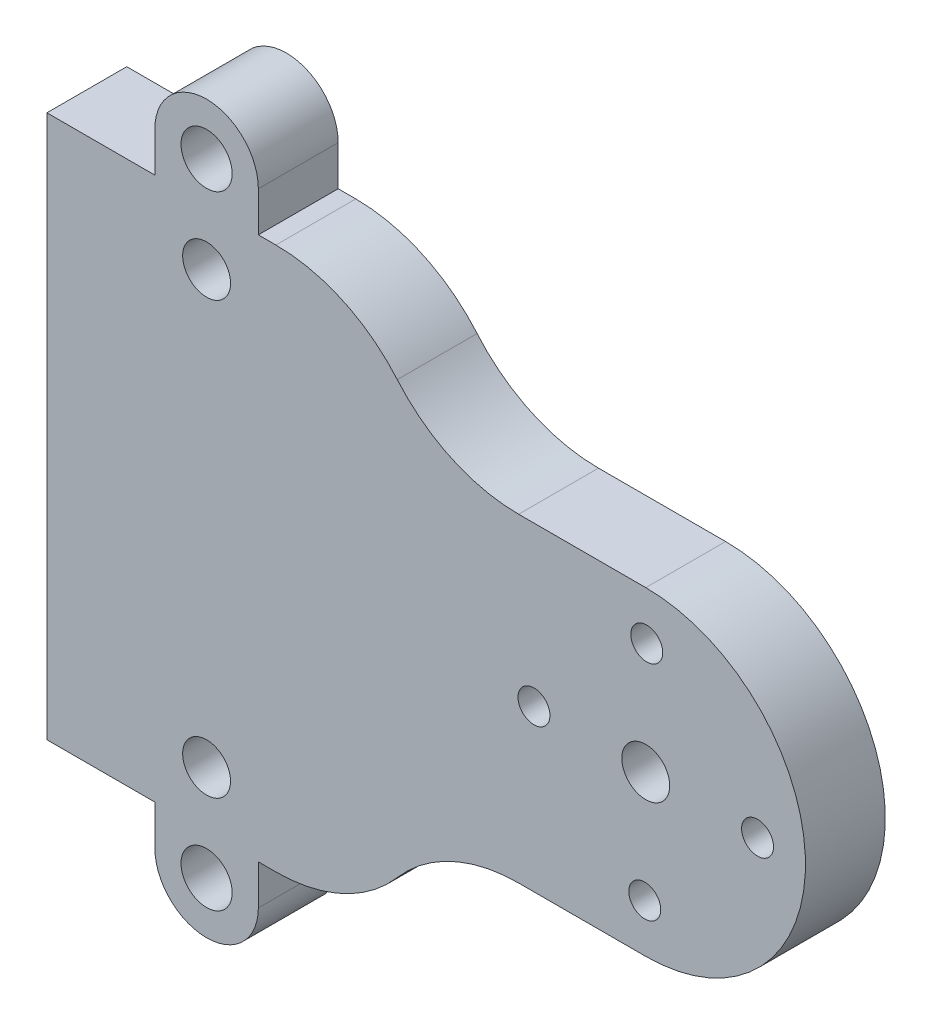
from build123d import *

# Parameters (mm, degrees)
ESQUISSE1_R             = 1
ESQUISSE1_R_2           = 1.5
BOSS_EXTRU_1_DEPTH      = 5
ENL_V_MAT_EXTRU_1_DEPTH = 5
ESQUISSE3_W             = 20
ESQUISSE3_H             = 34
BOSS_EXTRU_2_DEPTH      = 5
ESQUISSE4_R             = 1.5
ESQUISSE4_W             = 9.798464728
ESQUISSE4_H             = 39.858161606
ENL_V_MAT_EXTRU_2_DEPTH = 5
ESQUISSE5_W             = 2.5
ESQUISSE5_H             = 34
BOSS_EXTRU_3_DEPTH      = 5
ESQUISSE6_R             = 1.6
BOSS_EXTRU_4_DEPTH      = 5
CONG_1_R                = 10
CONG_2_R                = 10


with BuildPart() as part:
    # Esquisse1 → Boss.-Extru.1 (new body)
    with BuildSketch(Plane.XY):
        with BuildLine():
            Line((-13.584596858, -30.047129187), (-13.584596858, -25.547129187))
            Line((-13.584596858, -25.547129187), (-13.584596858, -25.297129187))
            Line((-13.584596858, -25.297129187), (-13.834596858, -25.297129187))
            Line((-13.834596858, -25.297129187), (-16.334596858, -25.297129187))
            Line((-16.334596858, -25.297129187), (-16.584596858, -25.297129187))
            Line((-16.584596858, -25.297129187), (-16.584596858, -25.047129187))
            Line((-16.584596858, -25.047129187), (-16.584596858, 6.452870813))
            Line((-16.584596858, 6.452870813), (-16.584596858, 6.702870813))
            Line((-16.584596858, 6.702870813), (-16.334596858, 6.702870813))
            Line((-16.334596858, 6.702870813), (-13.834596858, 6.702870813))
            Line((-13.834596858, 6.702870813), (-13.584596858, 6.702870813))
            Line((-13.584596858, 6.702870813), (-13.584596858, 6.952870813))
            Line((-13.584596858, 6.952870813), (-13.584596858, 11.452870813))
            Line((-13.584596858, 11.452870813), (-13.584596858, 11.702870813))
            Line((-13.584596858, 11.702870813), (-13.334596858, 11.702870813))
            Line((-13.334596858, 11.702870813), (-8.584596858, 11.702870813))
            Line((-8.584596858, 11.702870813), (-8.584596858, 6.702870813))
            Line((-8.584596858, 6.702870813), (-7.491776281, 6.702870813))
            Line((-7.491776281, 6.702870813), (-4.034541178, 6.702870813))
            ThreePointArc((-4.034541178, 6.702870813), (-0.161557832, 6.19424756), (3.448773595, 4.702870813))
            ThreePointArc((3.448773595, 4.702870813), (10.66943645, 1.720117321), (18.415403142, 0.702870813))
            ThreePointArc((18.415403142, 0.702870813), (28.415403142, -9.297129187), (18.415403142, -19.297129187))
            ThreePointArc((18.415403142, -19.297129187), (10.66943645, -20.314375694), (3.448773595, -23.297129187))
            ThreePointArc((3.448773595, -23.297129187), (-0.161557832, -24.788505933), (-4.034541178, -25.297129187))
            Line((-4.034541178, -25.297129187), (-7.491776281, -25.297129187))
            Line((-7.491776281, -25.297129187), (-8.584596858, -25.297129187))
            Line((-8.584596858, -25.297129187), (-8.584596858, -30.297129187))
            Line((-8.584596858, -30.297129187), (-13.334596858, -30.297129187))
            Line((-13.334596858, -30.297129187), (-13.584596858, -30.297129187))
            Line((-13.584596858, -30.297129187), (-13.584596858, -30.047129187))
        make_face()
        with Locations((18.477857718, -2.297129187)):
            Circle(ESQUISSE1_R, mode=Mode.SUBTRACT)
        with Locations((25.415403142, -9.359583762)):
            Circle(ESQUISSE1_R, mode=Mode.SUBTRACT)
        with Locations((18.415403142, -9.297129187)):
            Circle(ESQUISSE1_R_2, mode=Mode.SUBTRACT)
        with Locations((11.415403142, -9.234674611)):
            Circle(ESQUISSE1_R, mode=Mode.SUBTRACT)
        with Locations((18.352948567, -16.297129187)):
            Circle(ESQUISSE1_R, mode=Mode.SUBTRACT)
    extrude(amount=BOSS_EXTRU_1_DEPTH)

    # Esquisse2 → Enlèv. mat.-Extru.1 (cut)
    with BuildSketch(Plane(origin=(0, 0, 0), x_dir=(-1, 0, 0), z_dir=(0, 0, -1))):
        Polygon((1.584596858, -19.297129187), (1.584596858, -25.297129187), (1.584596858, -26.297129187), (21.584596858, -26.297129187), (21.584596858, -33.65697819), (-26.833247513, -33.65697819), (-26.198667142, -19.297129187), align=None)
        Polygon((21.584596858, 7.702870813), (1.584596858, 7.702870813), (1.584596858, 6.702870813), (1.584596858, 0.702870813), (-26.198667142, 0.702870813), (-26.833247513, 15.062719816), (21.584596858, 15.062719816), align=None)
    extrude(amount=-ENL_V_MAT_EXTRU_1_DEPTH, mode=Mode.SUBTRACT)

    # Esquisse3 → Boss.-Extru.2 (add)
    with BuildSketch(Plane(origin=(0, 0, 0), x_dir=(-1, 0, 0), z_dir=(0, 0, -1))):
        with Locations((11.584596858, -9.297129187)):
            Rectangle(ESQUISSE3_W, ESQUISSE3_H)
    extrude(amount=-BOSS_EXTRU_2_DEPTH)

    # Esquisse4 → Enlèv. mat.-Extru.2 (cut)
    with BuildSketch(Plane(origin=(0, 0, 0), x_dir=(-1, 0, 0), z_dir=(0, 0, -1))):
        with Locations((9.084596858, -22.797129187)):
            Circle(ESQUISSE4_R)
        with Locations((9.084596858, 4.202870813)):
            Circle(ESQUISSE4_R)
        with Locations((23.983829222, -9.020336398)):
            Rectangle(ESQUISSE4_W, ESQUISSE4_H)
    extrude(amount=-ENL_V_MAT_EXTRU_2_DEPTH, mode=Mode.SUBTRACT)

    # Esquisse5 → Boss.-Extru.3 (add)
    with BuildSketch(Plane(origin=(0, 0, 0), x_dir=(-1, 0, 0), z_dir=(0, 0, -1))):
        with Locations((0.334596858, -9.297129187)):
            Rectangle(ESQUISSE5_W, ESQUISSE5_H)
    extrude(amount=-BOSS_EXTRU_3_DEPTH)

    # Esquisse6 → Boss.-Extru.4 (add)
    # profile 1 of 2: a face of its own
    with BuildSketch(Plane(origin=(0, 0, 0), x_dir=(-1, 0, 0), z_dir=(0, 0, -1))):
        with BuildLine():
            Line((12.324596858, -25.12480516), (5.844596858, -25.12480516))
            Line((5.844596858, -25.12480516), (5.844596858, -28.797129187))
            ThreePointArc((5.844596858, -28.797129187), (9.084596858, -32.037129187), (12.324596858, -28.797129187))
            Line((12.324596858, -28.797129187), (12.324596858, -25.12480516))
        make_face()
        with Locations((9.084596858, -28.797129187)):
            Circle(ESQUISSE6_R, mode=Mode.SUBTRACT)
    # profile 2 of 2: a face of its own
    with BuildSketch(Plane(origin=(0, 0, 0), x_dir=(-1, 0, 0), z_dir=(0, 0, -1))):
        with BuildLine():
            Line((12.324596858, 6.757738308), (5.844596858, 6.757738308))
            Line((5.844596858, 6.757738308), (5.844596858, 10.202870813))
            ThreePointArc((5.844596858, 10.202870813), (9.084596858, 13.442870813), (12.324596858, 10.202870813))
            Line((12.324596858, 10.202870813), (12.324596858, 6.757738308))
        make_face()
        with Locations((9.084596858, 10.202870813)):
            Circle(ESQUISSE6_R, mode=Mode.SUBTRACT)
    extrude(amount=-BOSS_EXTRU_4_DEPTH)

    # Congé1
    # the kernel refuses this fillet: 10 mm, written as the material it adds along each edge
    with BuildSketch(Plane(origin=(0.915403142, 0.702870813, 0), x_dir=(1, 0, 0), z_dir=(0, 0, 1))) as cong_1_piece_1:
        with BuildLine():
            CenterArc((9.539392014, 10), CONG_1_R, 197.457603124, 72.542396876)
            Line((0, 7), (-0.19078784, 6.94))
            ThreePointArc((-0.19078784, 6.94), (-0.2, 3.5), (-0.2, 0))
            Line((-0.2, 0), (0, -0.2))
            Line((0, -0.2), (9.539392014, -0.2))
            Line((9.539392014, -0.2), (9.539392014, 0))
        make_face()
    extrude(amount=5)
    with BuildSketch(Plane(origin=(0.915403142, -19.297129187, 5), x_dir=(0, -1, 0), z_dir=(0, 0, -1))) as cong_1_piece_2:
        with BuildLine():
            CenterArc((10, -9.539392014), CONG_1_R, 107.457603124, 72.542396876)
            Line((0, -9.539392014), (-0.2, -9.539392014))
            Line((-0.2, -9.539392014), (-0.2, 0))
            Line((-0.2, 0), (0, 0.2))
            ThreePointArc((0, 0.2), (3.5, 0.2), (6.94, 0.19078784))
            Line((6.94, 0.19078784), (7, 0))
        make_face()
    extrude(amount=5)

    # Congé2
    cong_2_edges = [part.edges().sort_by_distance(p)[0] for p in [
        (0.915403142, -26.297129187, 2.5),
        (0.915403142, 7.702870813, 2.5),
    ]]
    fillet(cong_2_edges, radius=CONG_2_R)


solid = part.part
